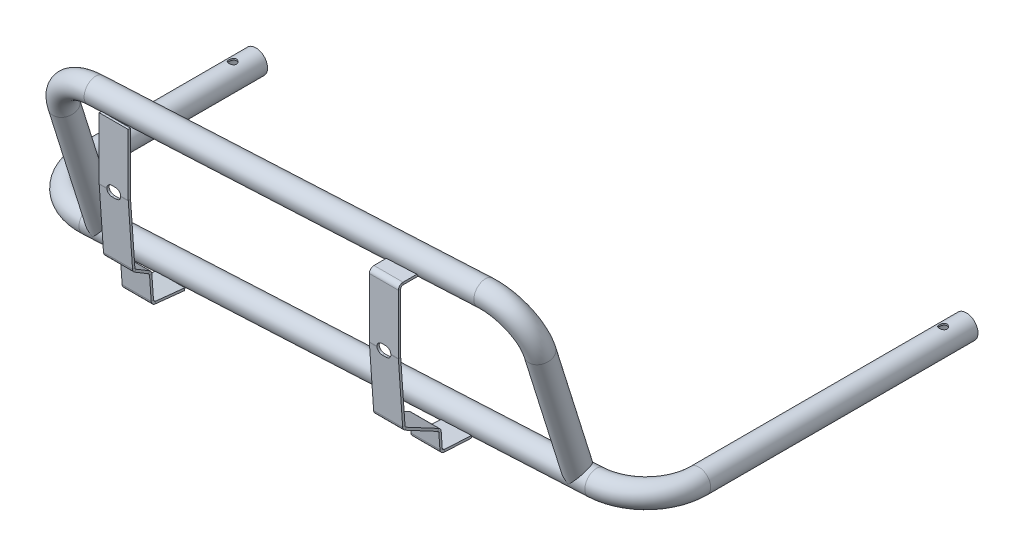
from build123d import *

# Parameters (mm, degrees)
SKETCH21_R                           = 10.033
SKETCH21_R_2                         = 8.763
CHASSIS_BUMPERFRAMEPROFILE_1_DEPTH   = 230
SKETCH21_ON_SEGMENT_2_R              = 10.033
SKETCH21_ON_SEGMENT_2_R_2            = 8.763
CHASSIS_BUMPERFRAMEPROFILE_1_2_ANGLE = 87
SKETCH21_ON_SEGMENT_3_R              = 10.033
SKETCH21_ON_SEGMENT_3_R_2            = 8.763
CHASSIS_BUMPERFRAMEPROFILE_1_3_DEPTH = 414
SKETCH21_ON_SEGMENT_4_R              = 10.033
SKETCH21_ON_SEGMENT_4_R_2            = 8.763
CHASSIS_BUMPERFRAMEPROFILE_1_4_ANGLE = 93
SKETCH21_ON_SEGMENT_5_R              = 10.033
SKETCH21_ON_SEGMENT_5_R_2            = 8.763
CHASSIS_BUMPERFRAMEPROFILE_1_5_DEPTH = 145
SKETCH2_R                            = 10.033
SKETCH2_R_2                          = 8.763
CHASSIS_BUMPERFRAMEPROFILE_3_DEPTH   = 114.554
SKETCH2_ON_SEGMENT_2_R               = 10.033
SKETCH2_ON_SEGMENT_2_R_2             = 8.763
CHASSIS_BUMPERFRAMEPROFILE_3_2_ANGLE = 90
SKETCH2_ON_SEGMENT_3_R               = 10.033
SKETCH2_ON_SEGMENT_3_R_2             = 8.763
CHASSIS_BUMPERFRAMEPROFILE_3_3_DEPTH = 319.024
SKETCH2_ON_SEGMENT_4_R               = 10.033
SKETCH2_ON_SEGMENT_4_R_2             = 8.763
CHASSIS_BUMPERFRAMEPROFILE_3_4_ANGLE = 90
SKETCH2_ON_SEGMENT_5_R               = 10.033
SKETCH2_ON_SEGMENT_5_R_2             = 8.763
CHASSIS_BUMPERFRAMEPROFILE_3_5_DEPTH = 114.554
CUT_EXTRUDE1_DEPTH                   = 641.192877482
CUT_EXTRUDE1_DEPTH_BACK              = 641.192877482
SKETCH22_R                           = 3.3
BASE_FLANGE1_DEPTH                   = 25
BASE_FLANGE2_START                   = -25
BASE_FLANGE2_DEPTH                   = 25
CUT_EXTRUDE2_DEPTH                   = 641.10002638
CUT_EXTRUDE2_DEPTH_BACK              = 641.10002638


# Read off the part's stored shape, not the designer's step: Base-Flange2
# Sheet-metal steps are written as plain solids
with BuildPart() as part:
    # Sketch21 → Chassis BUMPERFRAMEPROFILE(1) (new body)
    with BuildSketch(Plane.XY):
        Circle(SKETCH21_R)
        Circle(SKETCH21_R_2, mode=Mode.SUBTRACT)
    extrude(amount=CHASSIS_BUMPERFRAMEPROFILE_1_DEPTH)


with BuildPart() as body_2:
    # Sketch21 on segment 2 (carried to the start of arc 2) → Chassis BUMPERFRAMEPROFILE_1 2 (revolve)
    with BuildSketch(Plane.XY.offset(230)):
        Circle(SKETCH21_ON_SEGMENT_2_R)
        Circle(SKETCH21_ON_SEGMENT_2_R_2, mode=Mode.SUBTRACT)
    revolve(axis=Axis((-45.586880059, 0, 230), (0, -1, 0)), revolution_arc=CHASSIS_BUMPERFRAMEPROFILE_1_2_ANGLE)


with BuildPart() as body_3:
    # Sketch21 on segment 3 (carried to segment 3) → Chassis BUMPERFRAMEPROFILE_1 3 (new body)
    with BuildSketch(Plane(origin=(-43.201047099, 0, 275.524404825), x_dir=(0.052335956, 0, 0.998629535), z_dir=(-0.998629535, 0, 0.052335956))):
        Circle(SKETCH21_ON_SEGMENT_3_R)
        Circle(SKETCH21_ON_SEGMENT_3_R_2, mode=Mode.SUBTRACT)
    extrude(amount=CHASSIS_BUMPERFRAMEPROFILE_1_3_DEPTH)


with BuildPart() as body_4:
    # Sketch21 on segment 4 (carried to the start of arc 4) → Chassis BUMPERFRAMEPROFILE_1 4 (revolve)
    with BuildSketch(Plane(origin=(-456.633674488, 0, 297.191490709), x_dir=(0.052335956, 0, 0.998629535), z_dir=(-0.998629535, 0, 0.052335956))):
        Circle(SKETCH21_ON_SEGMENT_4_R)
        Circle(SKETCH21_ON_SEGMENT_4_R_2, mode=Mode.SUBTRACT)
    revolve(axis=Axis((-458.939616776, 0, 253.191490709), (0, -1, 0)), revolution_arc=CHASSIS_BUMPERFRAMEPROFILE_1_4_ANGLE)


with BuildPart() as body_5:
    # Sketch21 on segment 5 (carried to segment 5) → Chassis BUMPERFRAMEPROFILE_1 5 (new body)
    with BuildSketch(Plane(origin=(-503, 0, 108.191490709), x_dir=(1, 0, 0), z_dir=(0, 0, 1))):
        Circle(SKETCH21_ON_SEGMENT_5_R)
        Circle(SKETCH21_ON_SEGMENT_5_R_2, mode=Mode.SUBTRACT)
    extrude(amount=CHASSIS_BUMPERFRAMEPROFILE_1_5_DEPTH)


with BuildPart() as part_1:
    add(part.part)

    # Chassis BUMPERFRAMEPROFILE(1) as one body: union body 2, body 3, body 4, body 5
    add(body_2.part)
    add(body_3.part)
    add(body_4.part)
    add(body_5.part)

    # Sketch22 → Cut-Extrude1 (cut, two sides: drawn at the far end of the back side and taken through both)
    with BuildSketch(Plane(origin=(0, 0, 0), x_dir=(1, 0, 0), z_dir=(0, 1, 0)).offset(-CUT_EXTRUDE1_DEPTH_BACK)):
        with Locations(Location((-503, -128.191490709, 0), (0, 0, 270))):
            Circle(SKETCH22_R)
        with Locations(Location((0, -20, 0), (0, 0, 270))):
            Circle(SKETCH22_R)
    extrude(amount=CUT_EXTRUDE1_DEPTH + CUT_EXTRUDE1_DEPTH_BACK, mode=Mode.SUBTRACT)


with BuildPart() as body_2_2:
    # Sketch2 → Chassis BUMPERFRAMEPROFILE(3) (new body)
    with BuildSketch(Plane(origin=(-57, 0, 276.247577302), x_dir=(0.9997996400299483, -0.011764573523751414, -0.016194894435910545), z_dir=(0.01619489443591055, 0.9509186203780452, 0.30901699437494556))):
        Circle(SKETCH2_R)
        Circle(SKETCH2_R_2, mode=Mode.SUBTRACT)
    extrude(amount=CHASSIS_BUMPERFRAMEPROFILE_3_DEPTH)


with BuildPart() as body_3_2:
    # Sketch2 on segment 2 (carried to the start of arc 2) → Chassis BUMPERFRAMEPROFILE_3 2 (revolve)
    with BuildSketch(Plane(origin=(-55.144810063, 108.931531639, 311.646710076), x_dir=(0.99979964, -0.011764574, -0.016194894), z_dir=(0.016194894, 0.95091862, 0.309016994))):
        Circle(SKETCH2_ON_SEGMENT_2_R)
        Circle(SKETCH2_ON_SEGMENT_2_R_2, mode=Mode.SUBTRACT)
    revolve(axis=Axis((-90.351415715, 108.931531639, 313.491810094), (0.049767235, -0.309441073, 0.949615419)), revolution_arc=CHASSIS_BUMPERFRAMEPROFILE_3_2_ANGLE)


with BuildPart() as body_4_2:
    # Sketch2 on segment 3 (carried to segment 3) → Chassis BUMPERFRAMEPROFILE_3 3 (new body)
    with BuildSketch(Plane(origin=(-89.780465986, 142.45609276, 324.38617991), x_dir=(0.018075276, 0.938466556, 0.344896807), z_dir=(-0.998629535, 0, 0.052335956))):
        Circle(SKETCH2_ON_SEGMENT_3_R)
        Circle(SKETCH2_ON_SEGMENT_3_R_2, mode=Mode.SUBTRACT)
    extrude(amount=CHASSIS_BUMPERFRAMEPROFILE_3_3_DEPTH)


with BuildPart() as body_5_2:
    # Sketch2 on segment 4 (carried to the start of arc 4) → Chassis BUMPERFRAMEPROFILE_3 4 (revolve)
    with BuildSketch(Plane(origin=(-444.144810063, 108.931531639, 332.033336217), x_dir=(0.99979964, -0.011764574, -0.016194894), z_dir=(0.016194894, 0.95091862, 0.309016994))):
        Circle(SKETCH2_ON_SEGMENT_4_R)
        Circle(SKETCH2_ON_SEGMENT_4_R_2, mode=Mode.SUBTRACT)
    revolve(axis=Axis((-408.938204411, 108.931531639, 330.188236199), (-0.049767235, 0.309441073, -0.949615419)), revolution_arc=CHASSIS_BUMPERFRAMEPROFILE_3_4_ANGLE)


with BuildPart() as body_6:
    # Sketch2 on segment 5 (carried to segment 5) → Chassis BUMPERFRAMEPROFILE_3 5 (new body)
    with BuildSketch(Plane(origin=(-446, 0, 296.634203444), x_dir=(0.99979964, -0.011764574, -0.016194894), z_dir=(0.016194894, 0.95091862, 0.309016994))):
        Circle(SKETCH2_ON_SEGMENT_5_R)
        Circle(SKETCH2_ON_SEGMENT_5_R_2, mode=Mode.SUBTRACT)
    extrude(amount=CHASSIS_BUMPERFRAMEPROFILE_3_5_DEPTH)


with BuildPart() as body_2_2_1:
    add(body_2_2.part)

    # Chassis BUMPERFRAMEPROFILE(3) as one body: union body 3 2, body 4 2, body 5 2, body 6
    add(body_3_2.part)
    add(body_4_2.part)
    add(body_5_2.part)
    add(body_6.part)


with BuildPart() as body_3_3:
    # Sketch24 → Base-Flange1 (new body)
    with BuildSketch(Plane.ZY.offset(161.681792489)):
        with BuildLine():
            Line((328.15436876, 136.42309276), (338.201137507, 136.42309276))
            Line((338.201137507, 136.42309276), (347.901137507, 136.42309276))
            ThreePointArc((347.901137507, 136.42309276), (349.31535107, 135.837306322), (349.901137507, 134.42309276))
            Line((349.901137507, 134.42309276), (349.901137507, 83.492934299))
            ThreePointArc((349.901137507, 83.492934299), (349.899919161, 83.423135305), (349.896265608, 83.353421351))
            Line((349.896265608, 83.353421351), (346.211621215, 30.660551611))
            ThreePointArc((346.211621215, 30.660551611), (345.89383425, 29.710786488), (345.15543624, 29.034169372))
            Line((345.15543624, 29.034169372), (317.188825546, 14.164058695))
            ThreePointArc((317.188825546, 14.164058695), (315.712029525, 12.810824463), (315.076455596, 10.911294218))
            Line((315.076455596, 10.911294218), (314.168692751, -2.07031927))
            ThreePointArc((314.168692751, -2.07031927), (313.575383179, -3.357307221), (312.278236563, -3.928065392))
            Line((312.278236563, -3.928065392), (289.079523753, -5.143858412))
            Line((289.079523753, -5.143858412), (289.184195665, -7.141117482))
            Line((289.184195665, -7.141117482), (312.382908475, -5.925324461))
            ThreePointArc((312.382908475, -5.925324461), (314.977201707, -4.783808119), (316.163820851, -2.209832217))
            Line((316.163820851, -2.209832217), (317.071583696, 10.771781271))
            ThreePointArc((317.071583696, 10.771781271), (317.389370661, 11.721546393), (318.127768671, 12.398163509))
            Line((318.127768671, 12.398163509), (346.094379365, 27.268274187))
            ThreePointArc((346.094379365, 27.268274187), (347.571175386, 28.621508418), (348.206749315, 30.521038663))
            Line((348.206749315, 30.521038663), (351.891393708, 83.213908404))
            ThreePointArc((351.891393708, 83.213908404), (351.898700815, 83.353336312), (351.901137507, 83.492934298))
            Line((351.901137507, 83.492934299), (351.901137507, 134.42309276))
            ThreePointArc((351.901137507, 134.42309276), (350.729564632, 137.251519884), (347.901137507, 138.42309276))
            Line((347.901137507, 138.42309276), (338.201137507, 138.42309276))
            Line((338.201137507, 138.42309276), (328.15436876, 138.42309276))
            Line((328.15436876, 138.42309276), (328.15436876, 136.42309276))
        make_face()
    extrude(amount=-BASE_FLANGE1_DEPTH)


with BuildPart() as body_4_3:
    # Base-Flange2 outline → Base-Flange2 (new body)
    with BuildSketch(Plane.ZY.offset(395.67591037).offset(BASE_FLANGE2_START)):
        with BuildLine():
            ThreePointArc((328.577505796, -1.365431566), (328.021057296, -2.615235359), (326.791434622, -3.214962409))
            Line((326.791434622, -3.214962409), (301.608349358, -5.861811327))
            Line((301.608349358, -5.861811327), (301.817406285, -7.850855118))
            Line((301.817406285, -7.850855118), (327.000491549, -5.2040062))
            ThreePointArc((327.000491549, -5.2040062), (329.459736897, -4.0045521), (330.572633897, -1.504944513))
            Line((330.572633897, -1.504944513), (331.984472316, 18.685285538))
            ThreePointArc((331.984472316, 18.685285538), (332.274320088, 19.59076972), (332.949524267, 20.260107192))
            Line((332.949524267, 20.260107192), (344.672656598, 27.304075741))
            ThreePointArc((344.672656598, 27.304075741), (346.023064955, 28.642750685), (346.602760499, 30.453719049))
            Line((346.602760499, 30.453719049), (350.292112338, 83.213908404))
            ThreePointArc((350.292112338, 83.213908404), (350.299419445, 83.353336312), (350.301856137, 83.492934299))
            Line((350.301856137, 83.492934299), (350.301856137, 136.42309276))
            Line((350.301856137, 136.42309276), (348.301856137, 136.42309276))
            Line((348.301856137, 136.42309276), (348.301856137, 83.492934299))
            ThreePointArc((348.301856137, 83.492934299), (348.300637791, 83.423135305), (348.296984238, 83.353421351))
            Line((348.296984238, 83.353421351), (344.607632398, 30.593231996))
            ThreePointArc((344.607632398, 30.593231996), (344.317784627, 29.687747814), (343.642580448, 29.018410342))
            Line((343.642580448, 29.018410342), (331.919448117, 21.974441793))
            ThreePointArc((331.919448117, 21.974441793), (330.56903976, 20.635766849), (329.989344216, 18.824798486))
            Line((329.989344216, 18.824798486), (328.577505796, -1.365431566))
        make_face()
    extrude(amount=BASE_FLANGE2_DEPTH)


with BuildPart() as cut_extrude2_tool:
    # Sketch29 → Cut-Extrude2 (new, two sides: drawn at the far end of the back side and taken through both)
    with BuildSketch(Plane.XY.offset(351.101496822).offset(-CUT_EXTRUDE2_DEPTH_BACK)):
        with BuildLine():
            Line((-384.80091037, 87.728421351), (-381.55091037, 87.728421351))
            ThreePointArc((-381.55091037, 87.728421351), (-377.17591037, 83.353421351), (-381.55091037, 78.978421351))
            Line((-381.55091037, 78.978421351), (-384.80091037, 78.978421351))
            ThreePointArc((-384.80091037, 78.978421351), (-389.17591037, 83.353421351), (-384.80091037, 87.728421351))
        make_face()
        with BuildLine():
            Line((-150.806792489, 87.728421351), (-147.556792489, 87.728421351))
            ThreePointArc((-147.556792489, 87.728421351), (-143.181792489, 83.353421351), (-147.556792489, 78.978421351))
            Line((-147.556792489, 78.978421351), (-150.806792489, 78.978421351))
            ThreePointArc((-150.806792489, 78.978421351), (-155.181792489, 83.353421351), (-150.806792489, 87.728421351))
        make_face()
    extrude(amount=CUT_EXTRUDE2_DEPTH + CUT_EXTRUDE2_DEPTH_BACK)


with BuildPart() as body_3_3_1:
    add(body_3_3.part)

    # Cut-Extrude2: cut by cut_extrude2_tool
    add(cut_extrude2_tool.part, mode=Mode.SUBTRACT)


with BuildPart() as body_4_3_1:
    add(body_4_3.part)

    # Cut-Extrude2: cut by cut_extrude2_tool
    add(cut_extrude2_tool.part, mode=Mode.SUBTRACT)


solid = Compound([part_1.part, body_2_2_1.part, body_3_3_1.part, body_4_3_1.part])
